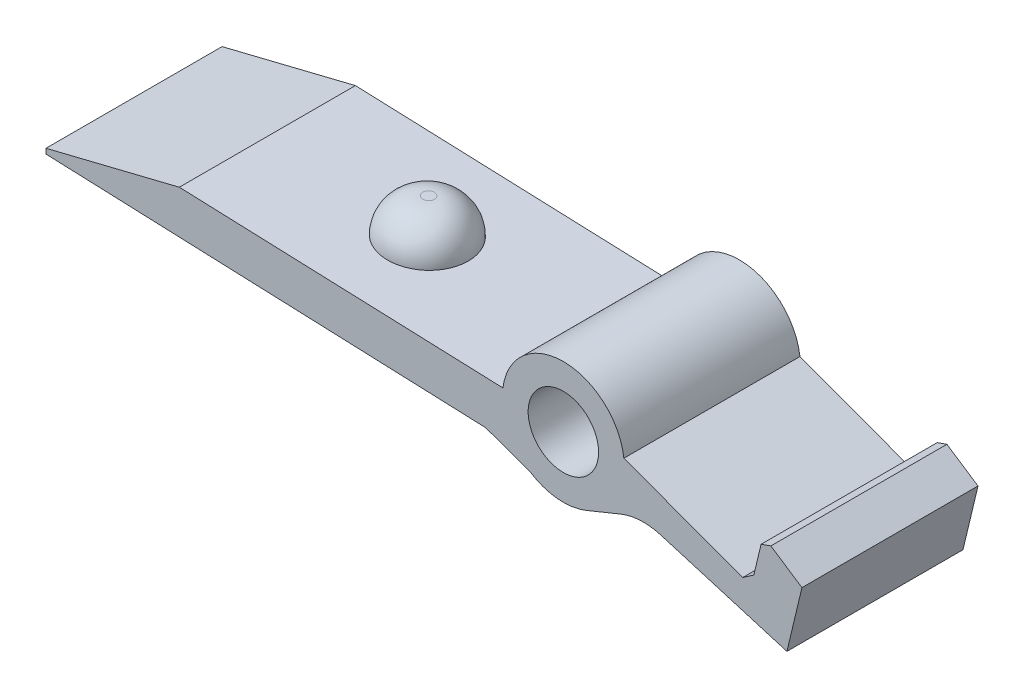
from build123d import *

# Parameters (mm, degrees)
SKETCH1_R           = 1.5
BOSS_EXTRUDE1_DEPTH = 7.5
FILLET1_R           = 2.54
CHAMFER2_SIZE       = 2.665692085
CHAMFER2_SIZE_2     = 5
SKETCH4_R           = 1.75
BOSS_EXTRUDE2_DEPTH = 1.5
FILLET2_R           = 1.500000048
CUT_EXTRUDE1_DEPTH  = 7.5


# Some blends are built 0.0001 mm under size
with BuildPart() as part:
    # Sketch1 → Boss-Extrude1 (new body)
    with BuildSketch(Plane.XY):
        with BuildLine():
            Line((17.881226168, -7.264400992), (12.820526555, -5.392684832))
            ThreePointArc((12.820526555, -5.392684832), (10.249738142, -3.113969145), (7.665252761, -5.377138064))
            Line((7.665252761, -5.377138064), (-11.113294597, -4.678112359))
            Line((-11.113294597, -4.678112359), (-11.797383791, -5.362201553))
            Line((-11.797383791, -5.362201553), (-11.797383791, -6.482688956))
            Line((-11.797383791, -6.482688956), (6.932172042, -7.212884314))
            Line((6.932172042, -7.212884314), (8.80911881, -7.87994093))
            ThreePointArc((8.80911881, -7.87994093), (9.985840847, -8.298026499), (11.221708583, -8.118858325))
            Line((11.221708583, -8.118858325), (13.521910205, -7.18234795))
            Line((13.521910205, -7.18234795), (20.245554573, -9.191065966))
            Line((20.245554573, -9.191065966), (20.849339495, -6.668640767))
            Line((20.849339495, -6.668640767), (19.081317898, -5.499046666))
            Line((19.081317898, -5.499046666), (18.665024161, -5.64566597))
            Line((18.665024161, -5.64566597), (18.356685028, -6.933810758))
            Line((18.356685028, -6.933810758), (17.881226168, -7.264400992))
        make_face()
        with Locations((10.241902304, -5.712315853)):
            Circle(SKETCH1_R, mode=Mode.SUBTRACT)
    extrude(amount=BOSS_EXTRUDE1_DEPTH)

    # Fillet1
    fillet1_edges = [part.edges().sort_by_distance(p)[0] for p in [
        (13.521910205, -7.18234795, 3.75),
    ]]
    fillet(fillet1_edges, radius=FILLET1_R)

    # Chamfer2
    # the kernel refuses this chamfer: 5, 2.665692085 mm, written as the material it takes off along each edge
    with BuildSketch(Plane(origin=(-11.113294597, -4.678112359, -12.981362455), x_dir=(-0.7323937898878367, -0.6808812940107337, 0), z_dir=(0, 0, 1))) as chamfer2_piece_1:
        Polygon((CHAMFER2_SIZE * 0.999336395545, CHAMFER2_SIZE * 0.0364248351519), (-CHAMFER2_SIZE_2 * 0.706558829098, CHAMFER2_SIZE_2 * 0.707654308984), (0, 0), align=None)
    extrude(amount=33.462724911, mode=Mode.SUBTRACT)

    # Sketch4 → Boss-Extrude2 (add)
    with BuildSketch(Plane(origin=(-0.189278476, -5.084755532, 0), x_dir=(0.9993078802351368, -0.03719893143569399, 0), z_dir=(0.03719893143569399, 0.9993078802351368, 0))):
        with Locations((0.885514773, -3.75)):
            Circle(SKETCH4_R)
    extrude(amount=BOSS_EXTRUDE2_DEPTH)

    # Fillet2
    fillet2_edges = [part.edges().sort_by_distance(p)[0] for p in [
        (-0.997366978, -3.553635785, 3.75),
    ]]
    fillet(fillet2_edges, radius=FILLET2_R - 0.0001)  # a hair under: the kernel refuses the full size

    # Sketch5 → Cut-Extrude1 (cut)
    with BuildSketch(Plane.XY.offset(7.5)):
        Polygon((20.405496385, -6.375026546), (19.765742241, -9.047719944), (20.245554573, -9.191065966), (20.849339495, -6.668640767), align=None)
    extrude(amount=-CUT_EXTRUDE1_DEPTH, mode=Mode.SUBTRACT)


solid = part.part
